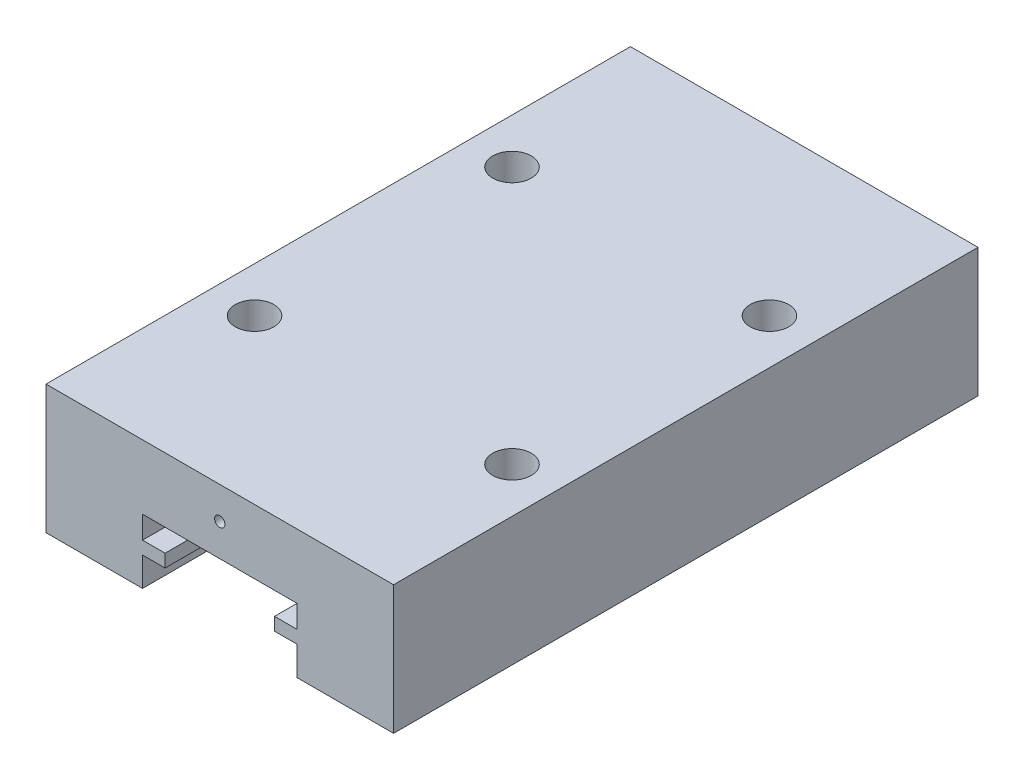
from build123d import *

# Parameters (mm, degrees)
DODANIE_WYCI_GNI_CIE1_DEPTH    = 45.4
OTWORY_USTALAJ_CE_1_0MM1_D     = 0.8
OTWORY_USTALAJ_CE_1_0MM1_DEPTH = 6.5
OTWORY_USTALAJ_CE_1_0MM1_TIP   = 0.240344248
OTWORY_USTALAJ_CE_1_0MM2_D     = 0.8
OTWORY_USTALAJ_CE_1_0MM2_DEPTH = 6.5
OTWORY_USTALAJ_CE_1_0MM2_TIP   = 0.240344248
OTWORY_USTALAJ_CE_3_0MM1_D     = 3
OTWORY_USTALAJ_CE_3_0MM1_DEPTH = 3.5
OTWORY_USTALAJ_CE_3_0MM1_TIP   = 0.901290929


with BuildPart() as part:
    # Szkic1 → Dodanie-wyciągnięcie1 (new body)
    with BuildSketch(Plane.XY):
        Polygon((7.5, 0), (7.5, 2.247882756), (9.25, 2.247882756), (9.25, 3.247882756), (7.5, 3.247882756), (7.5, 4.997882756), (19.5, 4.997882756), (19.5, 3.247882756), (17.75, 3.247882756), (17.75, 2.247882756), (19.5, 2.247882756), (19.5, 0), (27, 0), (27, 10), (0, 10), (0, 0), align=None)
    extrude(amount=DODANIE_WYCI_GNI_CIE1_DEPTH)

    # Otwory ustalające Ø1.0mm1
    with Locations(Plane.XY.offset(45.4)):
        with Locations((13.5, 7.5)):
            Hole(OTWORY_USTALAJ_CE_1_0MM1_D / 2, depth=OTWORY_USTALAJ_CE_1_0MM1_DEPTH)
            with Locations((0, 0, -(OTWORY_USTALAJ_CE_1_0MM1_DEPTH + OTWORY_USTALAJ_CE_1_0MM1_TIP / 2))):  # 118° drill point
                Cone(0, OTWORY_USTALAJ_CE_1_0MM1_D / 2, OTWORY_USTALAJ_CE_1_0MM1_TIP, mode=Mode.SUBTRACT)

    # Otwory ustalające Ø1.0mm2
    with Locations(Plane(origin=(0, 0, 0), x_dir=(-1, 0, 0), z_dir=(0, 0, -1))):
        with Locations((-13.5, 7.5)):
            Hole(OTWORY_USTALAJ_CE_1_0MM2_D / 2, depth=OTWORY_USTALAJ_CE_1_0MM2_DEPTH)
            with Locations((0, 0, -(OTWORY_USTALAJ_CE_1_0MM2_DEPTH + OTWORY_USTALAJ_CE_1_0MM2_TIP / 2))):  # 118° drill point
                Cone(0, OTWORY_USTALAJ_CE_1_0MM2_D / 2, OTWORY_USTALAJ_CE_1_0MM2_TIP, mode=Mode.SUBTRACT)

    # Otwory ustalające Ø3.0mm1
    with Locations(Plane(origin=(0, 10, 0), x_dir=(1, 0, 0), z_dir=(0, 1, 0))):
        with Locations((3.5, -32.7), (23.5, -32.7), (23.5, -12.7), (3.5, -12.7)):
            Hole(OTWORY_USTALAJ_CE_3_0MM1_D / 2, depth=OTWORY_USTALAJ_CE_3_0MM1_DEPTH)
            with Locations((0, 0, -(OTWORY_USTALAJ_CE_3_0MM1_DEPTH + OTWORY_USTALAJ_CE_3_0MM1_TIP / 2))):  # 118° drill point
                Cone(0, OTWORY_USTALAJ_CE_3_0MM1_D / 2, OTWORY_USTALAJ_CE_3_0MM1_TIP, mode=Mode.SUBTRACT)


solid = part.part
